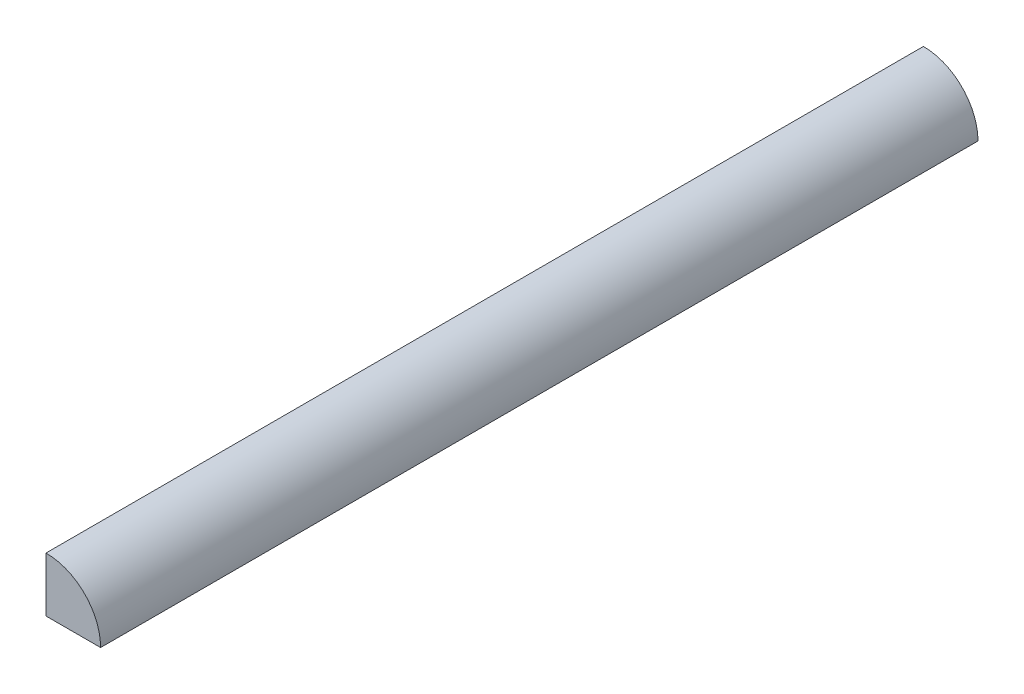
from build123d import *

# Parameters (mm, degrees)
ESQUISSE1_W        = 28
ESQUISSE1_H        = 28
BOSS_EXTRU_1_DEPTH = 450
CONG_1_R           = 28


with BuildPart() as part:
    # Esquisse1 → Boss.-Extru.1 (new body)
    with BuildSketch(Plane.XY):
        with Locations((14, -14)):
            Rectangle(ESQUISSE1_W, ESQUISSE1_H)
    extrude(amount=BOSS_EXTRU_1_DEPTH)

    # Congé1
    cong_1_edges = [part.edges().sort_by_distance(p)[0] for p in [
        (28, 0, 225),
    ]]
    fillet(cong_1_edges, radius=CONG_1_R - 0.0001)  # a hair under: the kernel refuses the full size


solid = part.part
